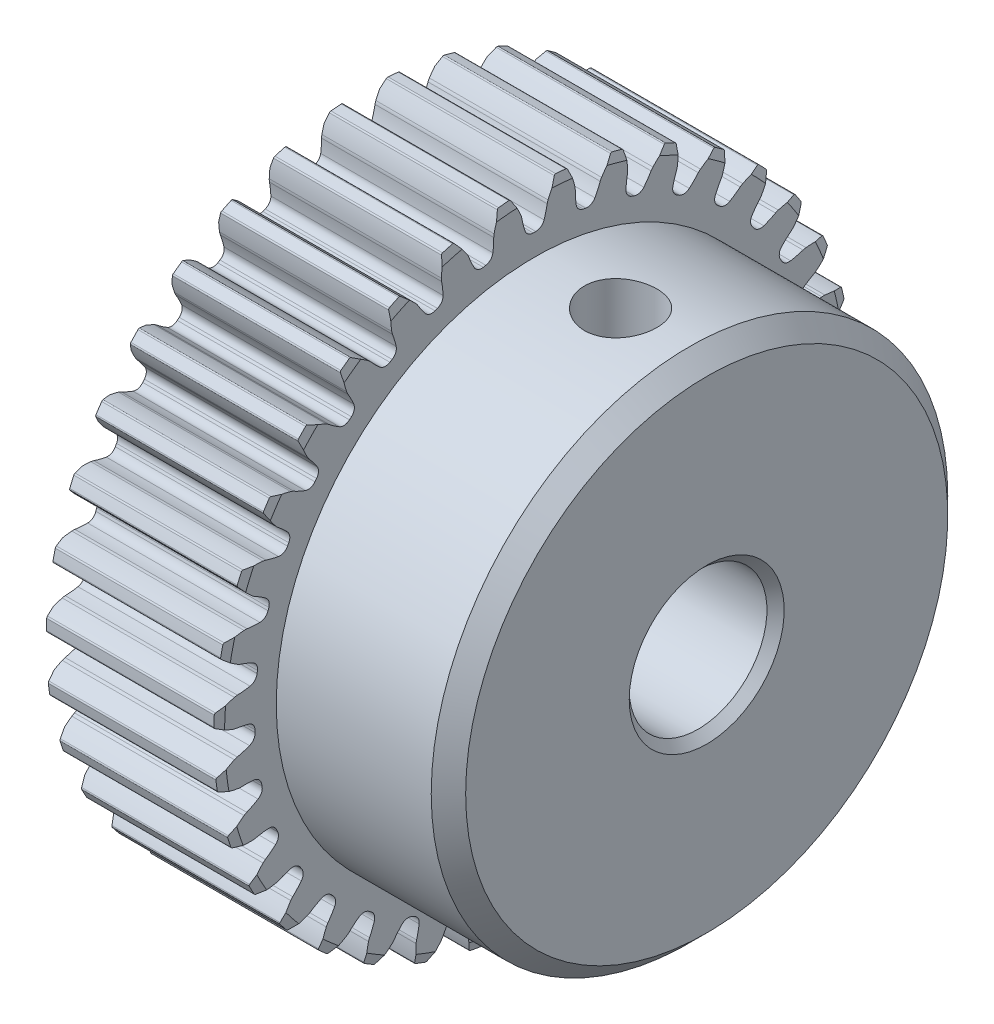
from build123d import *

# Parameters (mm, degrees)
CHAMFER1_SIZE       = 1
CHAMFER2_SIZE       = 0.5
CUT_EXTRUDE1_DEPTH  = 33.9317476
CIRPATTERN1_COUNT   = 35
TAPPED_HOLE1_REACH  = 49.712
TAPPED_HOLE1_BORE_R = 2.1


with BuildPart() as part:
    # Sketch1 → Revolve1 (revolve)
    with BuildSketch(Plane.XY, mode=Mode.PRIVATE) as revolve1_sk:
        Polygon((0, 4), (0, 18), (0.133974596, 18.5), (9.866025404, 18.5), (10, 18), (10, 15), (20, 15), (20, 4), align=None)
    revolve(revolve1_sk.sketch.rotate(Axis((0, 0, 0), (1, 0, 0)), 90), axis=Axis((0, 0, 0), (1, 0, 0)))

    # Chamfer1
    chamfer1_edges = [part.edges().sort_by_distance(p)[0] for p in [
        (20, 0, -15),
    ]]
    chamfer(chamfer1_edges, length=CHAMFER1_SIZE)

    # Chamfer2
    chamfer2_edges = [part.edges().sort_by_distance(p)[0] for p in [
        (20, 0, -4),
        (0, 0, -4),
    ]]
    chamfer(chamfer2_edges, length=CHAMFER2_SIZE)

    # Sketch2 → Cut-Extrude1 (cut, through all)
    with BuildSketch(Plane(origin=(0, 0, 0), x_dir=(0, 0, -1), z_dir=(1, 0, 0))):
        with BuildLine():
            ThreePointArc((1.269026187, 18.404371608), (1.006467064, 17.954193658), (0.785134531, 17.482378664))
            ThreePointArc((0.785134531, 17.482378664), (0.755643215, 17.399066685), (0.735256449, 17.313072479))
            ThreePointArc((0.735256449, 17.313072479), (0.656620662, 16.95039714), (0.553191246, 16.593999407))
            ThreePointArc((0.553191246, 16.593999407), (0.370480866, 16.344222155), (0.075759585, 16.249823399))
            ThreePointArc((0.075759585, 16.249823399), (0, 16.25), (-0.075759585, 16.249823399))
            ThreePointArc((-0.075759585, 16.249823399), (-0.370480866, 16.344222155), (-0.553191246, 16.593999407))
            ThreePointArc((-0.553191246, 16.593999407), (-0.656620662, 16.95039714), (-0.735256449, 17.313072479))
            ThreePointArc((-0.735256449, 17.313072479), (-0.755643215, 17.399066685), (-0.785134531, 17.482378664))
            ThreePointArc((-0.785134531, 17.482378664), (-1.006467064, 17.954193658), (-1.269026187, 18.404371608))
            ThreePointArc((-1.269026187, 18.404371608), (-1.308474401, 18.439687477), (-1.360424722, 18.449911777))
            ThreePointArc((-1.360424722, 18.449911777), (0, 18.5), (1.360424722, 18.449911777))
            ThreePointArc((1.360424722, 18.449911777), (1.308474401, 18.439687477), (1.269026187, 18.404371608))
        make_face()
    cut_extrude1 = extrude(amount=CUT_EXTRUDE1_DEPTH, mode=Mode.SUBTRACT)

    # CirPattern1: Cut-Extrude1 ×35 about axis
    cirpattern1_axis = Axis((0, 0, 0), (1, 0, 0))
    for i in range(1, CIRPATTERN1_COUNT):
        add(cut_extrude1.rotate(cirpattern1_axis, i * 360 / CIRPATTERN1_COUNT), mode=Mode.SUBTRACT)

    # Tapped Hole1 bore → Tapped Hole1 (cut, up to next)
    with BuildSketch(Plane(origin=(-8.5, 15, 0), x_dir=(1, 0, 0), z_dir=(0, 1, 0)), mode=Mode.PRIVATE) as tapped_hole1_sk1:
        with Locations((23.5, 0)):
            Circle(TAPPED_HOLE1_BORE_R)
    tapped_hole1_tool1 = extrude(tapped_hole1_sk1.sketch, amount=-TAPPED_HOLE1_REACH, mode=Mode.PRIVATE) & part.part
    add(tapped_hole1_tool1.solids().sort_by_distance((15, 15, 0))[0], mode=Mode.SUBTRACT)


solid = part.part
